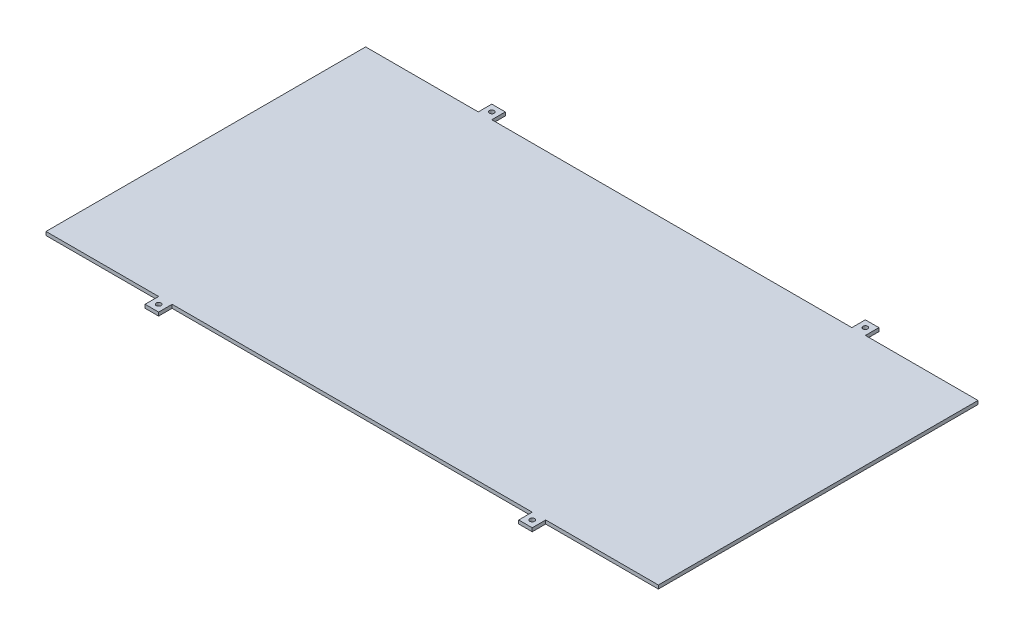
from build123d import *

# Parameters (mm, degrees)
SKETCH1_W           = 543.73
SKETCH1_H           = 3.175
BOSS_EXTRUDE1_DEPTH = 283.825
CUT_EXTRUDE1_DEPTH  = 1.3
SKETCH2_W           = 12
SKETCH2_H           = 12
SKETCH2_R           = 2.1
BOSS_EXTRUDE2_DEPTH = 3.125


with BuildPart() as part:
    # Sketch1 → Boss-Extrude1 (new body)
    with BuildSketch(Plane.XY):
        with Locations((-308.730031966, 1.266681686)):
            Rectangle(SKETCH1_W, SKETCH1_H)
    extrude(amount=BOSS_EXTRUDE1_DEPTH)

    # GasketGroove → Cut-Extrude1 (cut)
    with BuildSketch(Plane.XZ.offset(0.320818314)):
        with BuildLine():
            Line((-37.865031966, 2), (-37.865031966, 281.825))
            ThreePointArc((-37.865031966, 281.825), (-38.157925185, 282.532106781), (-38.865031966, 282.825))
            Line((-38.865031966, 282.825), (-578.595031966, 282.825))
            ThreePointArc((-578.595031966, 282.825), (-579.302138747, 282.532106781), (-579.595031966, 281.825))
            Line((-579.595031966, 281.825), (-579.595031966, 2))
            ThreePointArc((-579.595031966, 2), (-579.302138747, 1.292893219), (-578.595031966, 1))
            Line((-578.595031966, 1), (-38.865031966, 1))
            ThreePointArc((-38.865031966, 1), (-38.157925185, 1.292893219), (-37.865031966, 2))
        make_face()
        with BuildLine():
            Line((-577.595031966, 279.825), (-577.595031966, 4))
            ThreePointArc((-577.595031966, 4), (-577.302138747, 3.292893219), (-576.595031966, 3))
            Line((-576.595031966, 3), (-40.865031966, 3))
            ThreePointArc((-40.865031966, 3), (-40.157925185, 3.292893219), (-39.865031966, 4))
            Line((-39.865031966, 4), (-39.865031966, 279.825))
            ThreePointArc((-39.865031966, 279.825), (-40.157925185, 280.532106781), (-40.865031966, 280.825))
            Line((-40.865031966, 280.825), (-576.595031966, 280.825))
            ThreePointArc((-576.595031966, 280.825), (-577.302138747, 280.532106781), (-577.595031966, 279.825))
        make_face(mode=Mode.SUBTRACT)
    extrude(amount=-CUT_EXTRUDE1_DEPTH, mode=Mode.SUBTRACT)

    # Sketch2 → Boss-Extrude2 (add)
    # profile 1 of 4: a face of its own
    with BuildSketch(Plane(origin=(0, 2.854181686, 0), x_dir=(1, 0, 0), z_dir=(0, 1, 0))):
        with Locations((-474.595031966, -289.825)):
            Rectangle(SKETCH2_W, SKETCH2_H)
        with Locations((-474.595031966, -289.825)):
            Circle(SKETCH2_R, mode=Mode.SUBTRACT)
    # profile 2 of 4: a face of its own
    with BuildSketch(Plane(origin=(0, 2.854181686, 0), x_dir=(1, 0, 0), z_dir=(0, 1, 0))):
        with Locations((-142.865031966, -289.825)):
            Rectangle(SKETCH2_W, SKETCH2_H)
        with Locations((-142.865031966, -289.825)):
            Circle(SKETCH2_R, mode=Mode.SUBTRACT)
    # profile 3 of 4: a face of its own
    with BuildSketch(Plane(origin=(0, 2.854181686, 0), x_dir=(1, 0, 0), z_dir=(0, 1, 0))):
        with Locations((-142.865031966, 6)):
            Rectangle(SKETCH2_W, SKETCH2_H)
        with Locations((-142.865031966, 6)):
            Circle(SKETCH2_R, mode=Mode.SUBTRACT)
    # profile 4 of 4: a face of its own
    with BuildSketch(Plane(origin=(0, 2.854181686, 0), x_dir=(1, 0, 0), z_dir=(0, 1, 0))):
        with Locations((-474.595031966, 6)):
            Rectangle(SKETCH2_W, SKETCH2_H)
        with Locations((-474.595031966, 6)):
            Circle(SKETCH2_R, mode=Mode.SUBTRACT)
    extrude(amount=-BOSS_EXTRUDE2_DEPTH)


solid = part.part
